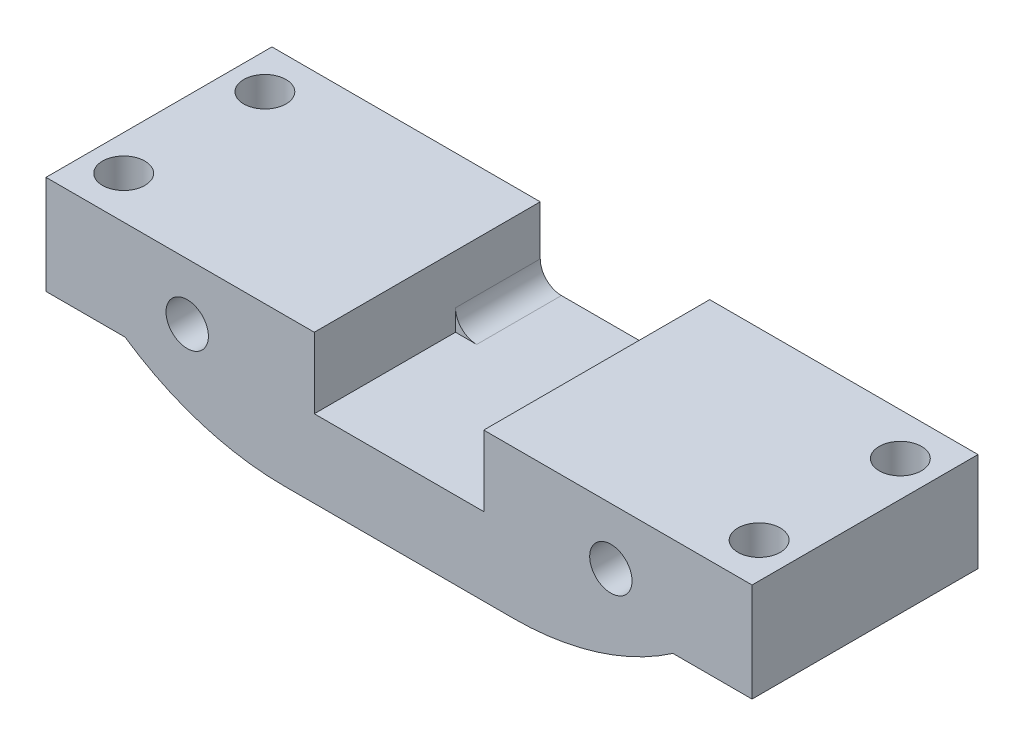
from build123d import *
from build123d.topology import SkipClean

# Parameters (mm, degrees)
SKETCH7_R               = 1.5
BOSS_EXTRUDE11_DEPTH    = 10
FILLET1_R               = 20
BOSS_EXTRUDE12_START    = 6
SKETCH9_R               = 1.5
BOSS_EXTRUDE12_DEPTH    = 6
CUT_EXTRUDE1_DEPTH      = 51.142297514
CUT_EXTRUDE1_DEPTH_BACK = 51.142297514
SKETCH10_R              = 1.5


with BuildPart() as part:
    # Sketch7 → Boss-Extrude11 (new body)
    with BuildSketch(Plane.XY):
        Polygon((11, 14.9), (-2, 14.9), (-2, 7.9), (3.598076211, 7.9), (3.598076211, 4.4), (42.4, 4.4), (42.4, 7.9), (48, 7.9), (48, 14.9), (35, 14.9), (29, 14.9), (29, 9.9), (17, 9.9), (17, 14.9), align=None)
        with Locations((8, 10.9)):
            Circle(SKETCH7_R, mode=Mode.SUBTRACT)
        with Locations((38, 10.9)):
            Circle(SKETCH7_R, mode=Mode.SUBTRACT)
    extrude(amount=BOSS_EXTRUDE11_DEPTH)

    # Fillet1
    # the kernel refuses this fillet: 20 mm, written as the material it takes off along each edge
    with BuildSketch(Plane(origin=(42.4, 4.4, -28.256636389), x_dir=(-1.4210854715172548e-12, 1.0, 0), z_dir=(0, 0, 1))) as fillet1_piece_1:
        with BuildLine():
            CenterArc((20, 11.302654555), FILLET1_R, 180, 34.41150867)
            Line((0, 11.302654555), (-0.4, 11.302654555))
            Line((-0.4, 11.302654555), (-0.4, 0))
            Line((-0.4, 0), (0, -0.4))
            ThreePointArc((0, -0.4), (1.75, -0.4), (3.17, -0.226053091))
            Line((3.17, -0.226053091), (3.5, 0))
        make_face()
    extrude(amount=66.513272777, mode=Mode.SUBTRACT)
    with BuildSketch(Plane(origin=(3.598076211, 4.4, -28.256636389), x_dir=(1, 0, 0), z_dir=(0, 0, 1))) as fillet1_piece_2:
        with BuildLine():
            CenterArc((11.302654555, 20), FILLET1_R, 235.58849133, 34.41150867)
            Line((0, 3.5), (-0.226053091, 3.17))
            ThreePointArc((-0.226053091, 3.17), (-0.4, 1.75), (-0.4, 0))
            Line((-0.4, 0), (0, -0.4))
            Line((0, -0.4), (11.302654555, -0.4))
            Line((11.302654555, -0.4), (11.302654555, 0))
        make_face()
    extrude(amount=66.513272777, mode=Mode.SUBTRACT)

    # Sketch9 → Boss-Extrude12 (add)
    with SkipClean():  # the faces are left unmerged after this step: merging them gives an invalid solid
        with BuildSketch(Plane(origin=(0, 0, 0), x_dir=(-1, 0, 0), z_dir=(0, 0, -1)).offset(BOSS_EXTRUDE12_START)):
            with BuildLine():
                Line((-48, 7.9), (-42.4, 7.9))
                ThreePointArc((-42.4, 7.9), (-37.013425228, 5.295026825), (-31.097345445, 4.4))
                Line((-31.097345445, 4.4), (-14.900730767, 4.4))
                ThreePointArc((-14.900730767, 4.4), (-8.984650984, 5.295026825), (-3.598076211, 7.9))
                Line((-3.598076211, 7.9), (2, 7.9))
                Line((2, 7.9), (2, 14.9))
                Line((2, 14.9), (-17, 14.9))
                Line((-17, 14.9), (-17, 11.4))
                ThreePointArc((-17, 11.4), (-17.439339828, 10.339339828), (-18.5, 9.9))
                Line((-18.5, 9.9), (-27.5, 9.9))
                ThreePointArc((-27.5, 9.9), (-28.560660172, 10.339339828), (-29, 11.4))
                Line((-29, 11.4), (-29, 14.9))
                Line((-29, 14.9), (-48, 14.9))
                Line((-48, 14.9), (-48, 7.9))
            make_face()
            with Locations((-38, 10.9)):
                Circle(SKETCH9_R, mode=Mode.SUBTRACT)
            with Locations((-8, 10.9)):
                Circle(SKETCH9_R, mode=Mode.SUBTRACT)
        extrude(amount=-BOSS_EXTRUDE12_DEPTH)

    # Sketch10 → Cut-Extrude1 (cut, two sides: drawn at the far end of the back side and taken through both)
    with SkipClean():  # the faces are left unmerged after this step: merging them gives an invalid solid
        with BuildSketch(Plane(origin=(0, 14.9, 0), x_dir=(1, 0, 0), z_dir=(0, 1, 0)).offset(-CUT_EXTRUDE1_DEPTH_BACK)):
            with Locations(Location((0.5, -7, 0), (0, 0, 180))):
                Circle(SKETCH10_R)
            with Locations(Location((0.5, 3, 0), (0, 0, 180))):
                Circle(SKETCH10_R)
            with Locations(Location((45.5, -7, 0), (0, 0, 180))):
                Circle(SKETCH10_R)
            with Locations(Location((45.5, 3, 0), (0, 0, 180))):
                Circle(SKETCH10_R)
        extrude(amount=CUT_EXTRUDE1_DEPTH + CUT_EXTRUDE1_DEPTH_BACK, mode=Mode.SUBTRACT)


solid = part.part
